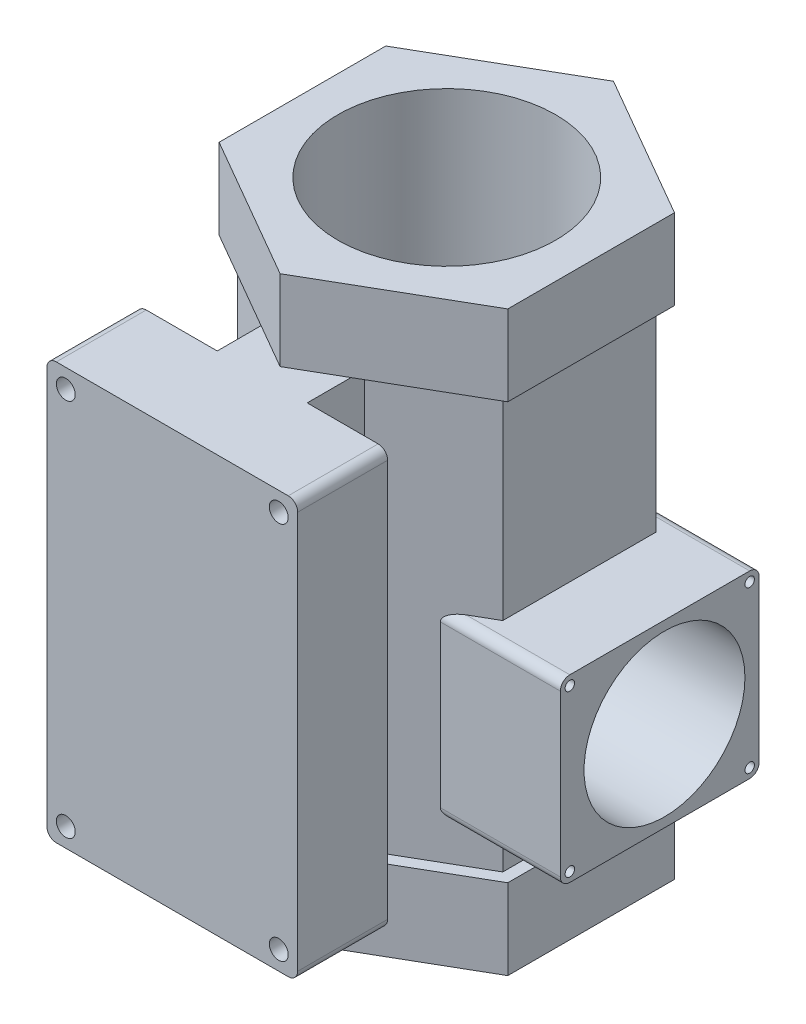
from build123d import *

# Parameters (mm, degrees)
EXTRUDE_1_DEPTH         = 85
EXTRUDE_791_DEPTH       = 440
EXTRUDE_2_DEPTH         = 85
EXTRUDE_1463_DEPTH      = 85
EXTRUDE_1463_DEPTH_BACK = 140
SKETCH_10_W             = 210
SKETCH_10_H             = 190
SKETCH_5_R              = 115
CUT_EXTRUDE_1525_DEPTH  = 712.91642768
CUT_EXTRUDE_1685_REACH  = 710.683
SKETCH_12_R             = 85
CUT_EXTRUDE_2074_REACH  = 739.219
SKETCH_13_R             = 10
SKETCH_14_R             = 5
CUT_EXTRUDE_6_DEPTH     = 30
FILLET_2_R              = 10
FILLET_3_R              = 10


with BuildPart() as part:
    # Эскиз2 → Боковой многогранник 1 (new body)
    with BuildSketch(Plane(origin=(0, 0, 0), x_dir=(1, 0, 0), z_dir=(0, 1, 0))):
        Polygon((0, 176.091832103), (-152.5, 88.045916051), (-152.5, -88.045916051), (0, -176.091832103), (152.5, -88.045916051), (152.5, 88.045916051), align=None)
    extrude(amount=EXTRUDE_1_DEPTH)

    # Sketch 337 → Extrude 791 (add)
    with BuildSketch(Plane(origin=(0, 0, 0), x_dir=(1, 0, 0), z_dir=(0, 1, 0))):
        Polygon((0, 161.658075373), (-140, 80.829037687), (-140, -80.829037687), (-47.5, -134.233937587), (-47.5, -195), (-132.5, -195), (-132.5, -290), (132.5, -290), (132.5, -195), (47.5, -195), (47.5, -134.233937587), (140, -80.829037687), (140, 80.829037687), align=None)
    extrude(amount=-EXTRUDE_791_DEPTH)

    # Эскиз4 → Боковой многогранник 2 (add)
    with BuildSketch(Plane.XZ.offset(440)):
        Polygon((0, -176.091832103), (152.5, -88.045916051), (152.5, 88.045916051), (0, 176.091832103), (-152.5, 88.045916051), (-152.5, -88.045916051), align=None)
    extrude(amount=EXTRUDE_2_DEPTH)

    # Эскиз10 → Extrude 1463 (add, two sides: drawn at the far end of the back side and taken through both)
    with BuildSketch(Plane(origin=(140, 0, 0), x_dir=(0, 0, -1), z_dir=(1, 0, 0)).offset(-EXTRUDE_1463_DEPTH_BACK)):
        with Locations((0, -305)):
            Rectangle(SKETCH_10_W, SKETCH_10_H)
    extrude(amount=EXTRUDE_1463_DEPTH + EXTRUDE_1463_DEPTH_BACK)

    # Эскиз5 → Cut-Extrude 1525 (cut, through all)
    with BuildSketch(Plane(origin=(0, 85, 0), x_dir=(1, 0, 0), z_dir=(0, 1, 0))):
        Circle(SKETCH_5_R)
    extrude(amount=-CUT_EXTRUDE_1525_DEPTH, mode=Mode.SUBTRACT)

    # Эскиз12 → Cut-Extrude 1685 (cut, up to next)
    with BuildSketch(Plane(origin=(225, 0, 0), x_dir=(0, 0, -1), z_dir=(1, 0, 0)), mode=Mode.PRIVATE) as cut_extrude_1685_sk1:
        with Locations((5, -305)):
            Circle(SKETCH_12_R)
    cut_extrude_1685_tool1 = extrude(cut_extrude_1685_sk1.sketch, amount=-CUT_EXTRUDE_1685_REACH, mode=Mode.PRIVATE) & part.part
    add(cut_extrude_1685_tool1.solids().sort_by_distance((225, -305, -5))[0], mode=Mode.SUBTRACT)

    # Эскиз13 → Cut-Extrude 2074 (cut, up to next)
    with BuildSketch(Plane.XY.offset(290), mode=Mode.PRIVATE) as cut_extrude_2074_sk1:
        with Locations((-112.5, -420)):
            Circle(SKETCH_13_R)
    cut_extrude_2074_tool1 = extrude(cut_extrude_2074_sk1.sketch, amount=-CUT_EXTRUDE_2074_REACH, mode=Mode.PRIVATE) & part.part
    # Эскиз13 → Cut-Extrude 2074 (cut, up to next)
    with BuildSketch(Plane.XY.offset(290), mode=Mode.PRIVATE) as cut_extrude_2074_sk2:
        with Locations((112.5, -420)):
            Circle(SKETCH_13_R)
    cut_extrude_2074_tool2 = extrude(cut_extrude_2074_sk2.sketch, amount=-CUT_EXTRUDE_2074_REACH, mode=Mode.PRIVATE) & part.part
    # Эскиз13 → Cut-Extrude 2074 (cut, up to next)
    with BuildSketch(Plane.XY.offset(290), mode=Mode.PRIVATE) as cut_extrude_2074_sk3:
        with Locations((-112.5, -20)):
            Circle(SKETCH_13_R)
    cut_extrude_2074_tool3 = extrude(cut_extrude_2074_sk3.sketch, amount=-CUT_EXTRUDE_2074_REACH, mode=Mode.PRIVATE) & part.part
    # Эскиз13 → Cut-Extrude 2074 (cut, up to next)
    with BuildSketch(Plane.XY.offset(290), mode=Mode.PRIVATE) as cut_extrude_2074_sk4:
        with Locations((112.5, -20)):
            Circle(SKETCH_13_R)
    cut_extrude_2074_tool4 = extrude(cut_extrude_2074_sk4.sketch, amount=-CUT_EXTRUDE_2074_REACH, mode=Mode.PRIVATE) & part.part
    add(cut_extrude_2074_tool1.solids().sort_by_distance((-112.5, -420, 290))[0], mode=Mode.SUBTRACT)
    add(cut_extrude_2074_tool2.solids().sort_by_distance((112.5, -420, 290))[0], mode=Mode.SUBTRACT)
    add(cut_extrude_2074_tool3.solids().sort_by_distance((-112.5, -20, 290))[0], mode=Mode.SUBTRACT)
    add(cut_extrude_2074_tool4.solids().sort_by_distance((112.5, -20, 290))[0], mode=Mode.SUBTRACT)

    # Эскиз14 → Вырез-Вытянуть6 (cut)
    with BuildSketch(Plane(origin=(225, 0, 0), x_dir=(0, 0, -1), z_dir=(1, 0, 0))):
        with Locations((95, -220)):
            Circle(SKETCH_14_R)
        with Locations((95, -390)):
            Circle(SKETCH_14_R)
        with Locations((-95, -220)):
            Circle(SKETCH_14_R)
        with Locations((-95, -390)):
            Circle(SKETCH_14_R)
    extrude(amount=-CUT_EXTRUDE_6_DEPTH, mode=Mode.SUBTRACT)

    # Скругление2
    fillet_2_edges = [part.edges().sort_by_distance(p)[0] for p in [
        (-132.5, -440, 242.5),
        (132.5, -440, 242.5),
        (-132.5, 0, 242.5),
        (132.5, 0, 242.5),
    ]]
    fillet(fillet_2_edges, radius=FILLET_2_R)

    # Скругление3
    fillet_3_edges = [part.edges().sort_by_distance(p)[0] for p in [
        (161.567332603, -210, -105),
        (161.567332603, -400, -105),
        (161.567332603, -400, 105),
        (161.567332603, -210, 105),
    ]]
    fillet(fillet_3_edges, radius=FILLET_3_R)


solid = part.part
